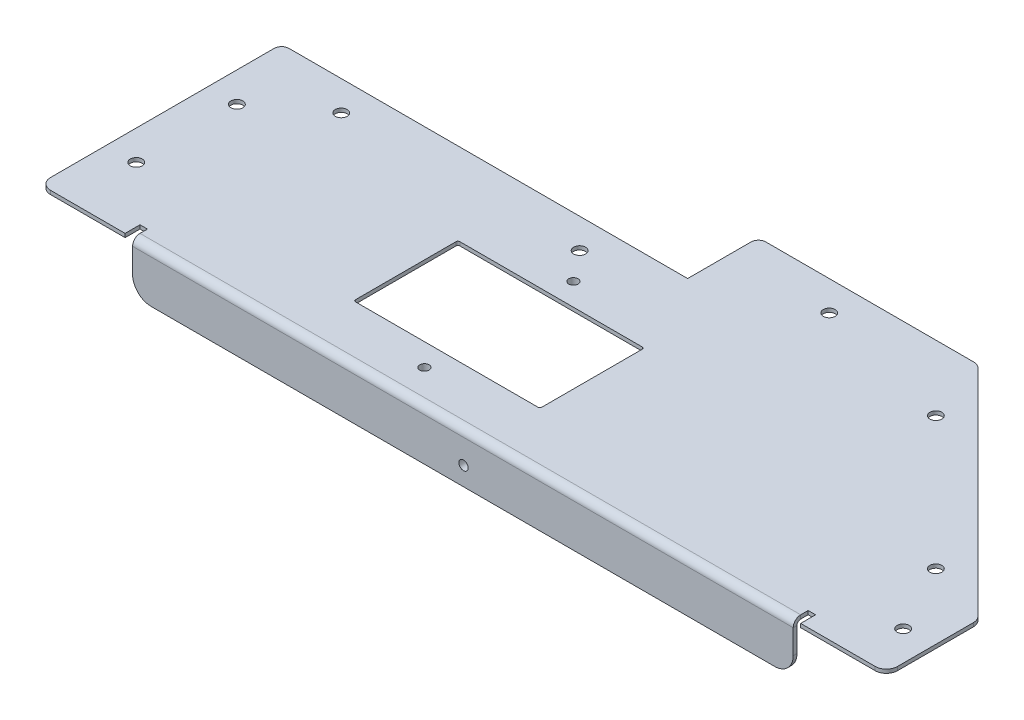
from build123d import *

# Parameters (mm, degrees)
SKETCH_1_R                        = 1.6
SM_BASE_FLANGE_1_DEPTH            = 1
SKETCH_2_R                        = 3
EXTRUDE_1_DEPTH                   = 2
HOLE_WIZARD_M3_1_D                = 2.5
SM_EDGE_FLANGE_1_STRIP_W          = 6
SM_EDGE_FLANGE_1_STRIP_H          = 1
SM_EDGE_FLANGE_1_STRIP_CUT_DEPTH  = 177.34
SM_EDGE_FLANGE_1_RELIEF_W         = 8
SM_EDGE_FLANGE_1_RELIEF_H         = 2
SM_EDGE_FLANGE_1_RELIEF_CUT_DEPTH = 1
SM_EDGE_FLANGE_1_DEPTH            = 177.34
SM_EDGE_FLANGE_1_FLAT_DEPTH       = 1
SKETCH_8_R                        = 3
EXTRUDE_2_DEPTH                   = 2
HOLE_WIZARD_M3_2_D                = 2.5


# Sheet-metal steps are written as plain solids
with BuildPart() as part:
    # Sketch 1 → 基体-法兰1 (new body)
    with BuildSketch(Plane(origin=(0, 0, 0), x_dir=(1, 0, 0), z_dir=(0, 1, 0))):
        with BuildLine():
            Line((-113.67, 31.388001247), (-113.67, -28.611998753))
            ThreePointArc((-113.67, -28.611998753), (-112.791320344, -30.733319096), (-110.67, -31.611998753))
            Line((-110.67, -31.611998753), (110.67, -31.611998753))
            ThreePointArc((110.67, -31.611998753), (112.791320344, -30.733319096), (113.67, -28.611998753))
            Line((113.67, -28.611998753), (113.67, -8.25463944))
            ThreePointArc((113.67, -8.25463944), (113.441638598, -7.106589143), (112.791320344, -6.133319096))
            Line((112.791320344, -6.133319096), (55.148679656, 51.509321591))
            ThreePointArc((55.148679656, 51.509321591), (54.17540961, 52.159639845), (53.027359313, 52.388001247))
            Line((53.027359313, 52.388001247), (-2.67, 52.388001247))
            ThreePointArc((-2.67, 52.388001247), (-4.084213562, 51.80221481), (-4.67, 50.388001247))
            Line((-4.67, 50.388001247), (-4.67, 33.388001247))
            Line((-4.67, 33.388001247), (-111.67, 33.388001247))
            ThreePointArc((-111.67, 33.388001247), (-113.084213562, 32.80221481), (-113.67, 31.388001247))
        make_face()
        with Locations(Location((-105.67, -13.611998753, 0), (0, 0, 270))):
            Circle(SKETCH_1_R, mode=Mode.SUBTRACT)
        with Locations(Location((-105.67, 13.388001247, 0), (0, 0, 270))):
            Circle(SKETCH_1_R, mode=Mode.SUBTRACT)
        with Locations(Location((-89.67, 25.388001247, 0), (0, 0, 270))):
            Circle(SKETCH_1_R, mode=Mode.SUBTRACT)
        with Locations(Location((-25.67, 25.388001247, 0), (0, 0, 270))):
            Circle(SKETCH_1_R, mode=Mode.SUBTRACT)
        with Locations(Location((22.33, 44.388001247, 0), (0, 0, 270))):
            Circle(SKETCH_1_R, mode=Mode.SUBTRACT)
        with Locations(Location((60.516291501, 34.828001247, 0), (0, 0, 270))):
            Circle(SKETCH_1_R, mode=Mode.SUBTRACT)
        with Locations(Location((96.116291501, -0.771998753, 0), (0, 0, 270))):
            Circle(SKETCH_1_R, mode=Mode.SUBTRACT)
        with Locations(Location((105.67, -19.111998753, 0), (0, 0, 270))):
            Circle(SKETCH_1_R, mode=Mode.SUBTRACT)
        with BuildLine():
            Line((-43.83, 11.388001247), (5.17, 11.388001247))
            ThreePointArc((5.17, 11.388001247), (5.523553391, 11.241554638), (5.67, 10.888001247))
            Line((5.67, 10.888001247), (5.67, -16.111998753))
            ThreePointArc((5.67, -16.111998753), (5.523553391, -16.465552143), (5.17, -16.611998753))
            Line((5.17, -16.611998753), (-43.83, -16.611998753))
            ThreePointArc((-43.83, -16.611998753), (-44.183553391, -16.465552143), (-44.33, -16.111998753))
            Line((-44.33, -16.111998753), (-44.33, 10.888001247))
            ThreePointArc((-44.33, 10.888001247), (-44.183553391, 11.241554638), (-43.83, 11.388001247))
        make_face(mode=Mode.SUBTRACT)
    extrude(amount=-SM_BASE_FLANGE_1_DEPTH)

    # Sketch 2 → 凸台-拉伸1 (add)
    with BuildSketch(Plane.XZ.offset(1)):
        with Locations(Location((-19.33, -17.388001247, 0), (0, 0, 90))):
            Circle(SKETCH_2_R)
        with Locations(Location((-19.33, 22.611998753, 0), (0, 0, 90))):
            Circle(SKETCH_2_R)
    extrude(amount=EXTRUDE_1_DEPTH)

    # M3 螺纹孔1 (through all)
    with Locations(Plane(origin=(0, -3, 0), x_dir=(-1, 0, 0), z_dir=(0, -1, 0))):
        with Locations((19.33, 17.388001247), (19.33, -22.611998753)):
            Hole(HOLE_WIZARD_M3_1_D / 2)

    # 边线-法兰1 strip (across the edge) → 边线-法兰1 strip cut (cut)
    with BuildSketch(Plane(origin=(88.67, -1, 31.611998753), x_dir=(0, 0, -1), z_dir=(-1, 0, 0))):
        with Locations((-1, -0.5)):
            Rectangle(SM_EDGE_FLANGE_1_STRIP_W, SM_EDGE_FLANGE_1_STRIP_H)
    extrude(amount=SM_EDGE_FLANGE_1_STRIP_CUT_DEPTH, mode=Mode.SUBTRACT)

    # 边线-法兰1 relief (on the sheet) → 边线-法兰1 relief cut (cut)
    with BuildSketch(Plane(origin=(88.67, -1, 29.611998753), x_dir=(0, 0, -1), z_dir=(0, -1, 0))):
        with Locations((-2, 1)):
            Rectangle(SM_EDGE_FLANGE_1_RELIEF_W, SM_EDGE_FLANGE_1_RELIEF_H)
        with Locations((-2, -178.34)):
            Rectangle(SM_EDGE_FLANGE_1_RELIEF_W, SM_EDGE_FLANGE_1_RELIEF_H)
    extrude(amount=-SM_EDGE_FLANGE_1_RELIEF_CUT_DEPTH, mode=Mode.SUBTRACT)

    # 边线-法兰1 bend section (across the edge) → 边线-法兰1 (add)
    with BuildSketch(Plane(origin=(88.67, -1, 31.611998753), x_dir=(0, 0, -1), z_dir=(-1, 0, 0))):
        with BuildLine():
            Line((0, 1), (1, 1))
            ThreePointArc((1, 1), (1.292893219, 0.292893219), (2, 0))
            Line((2, 0), (2, -1))
            ThreePointArc((2, -1), (0.585786438, -0.414213562), (0, 1))
        make_face()
    extrude(amount=SM_EDGE_FLANGE_1_DEPTH)

    # 边线-法兰1 profile (on flange) → 边线-法兰1 flat (add)
    with BuildSketch(Plane(origin=(0, -1, 31.611998753), x_dir=(-1, 0, 0), z_dir=(0, 0, 1))):
        with BuildLine():
            Line((83.67, 12.5), (-83.67, 12.5))
            ThreePointArc((-83.67, 12.5), (-87.205533906, 11.035533906), (-88.67, 7.5))
            Line((-88.67, 7.5), (-88.67, 1))
            Line((-88.67, 1), (88.67, 1))
            Line((88.67, 1), (88.67, 7.5))
            ThreePointArc((88.67, 7.5), (87.205533906, 11.035533906), (83.67, 12.5))
        make_face()
    extrude(amount=-SM_EDGE_FLANGE_1_FLAT_DEPTH)

    # 草图8 → 凸台-拉伸2 (add)
    with BuildSketch(Plane(origin=(0, 0, 30.611998753), x_dir=(-1, 0, 0), z_dir=(0, 0, -1))):
        with Locations(Location((-0.17, -8.5, 0), (0, 0, 270))):
            Circle(SKETCH_8_R)
    extrude(amount=EXTRUDE_2_DEPTH)

    # M3 螺纹孔2 (through all)
    with Locations(Plane(origin=(0, 0, 28.611998753), x_dir=(-1, 0, 0), z_dir=(0, 0, -1))):
        with Locations((-0.17, -8.5)):
            Hole(HOLE_WIZARD_M3_2_D / 2)


solid = part.part
